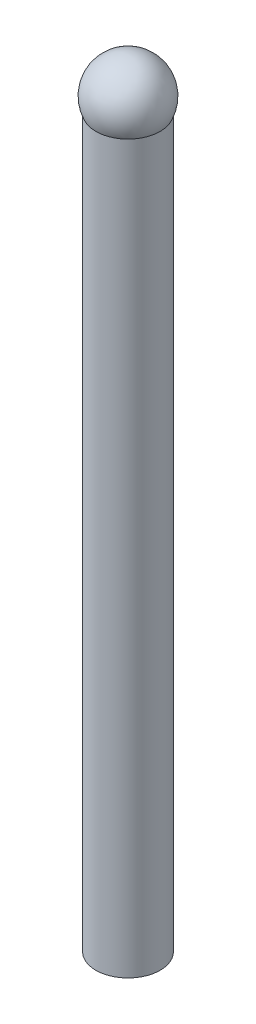
from build123d import *

# Parameters (mm, degrees)
SKETCH_1_R      = 0.65
EXTRUDE_1_DEPTH = 15


with BuildPart() as part:
    # Эскиз1 → Бобышка-Вытянуть1 (new body)
    with BuildSketch(Plane(origin=(0, 0, 0), x_dir=(1, 0, 0), z_dir=(0, 1, 0))):
        Circle(SKETCH_1_R)
    extrude(amount=EXTRUDE_1_DEPTH)

    # Эскиз3 → Повернуть23 (revolve)
    with BuildSketch(Plane.XY):
        with BuildLine():
            Line((-0.715433282, 15.000896847), (0.715433282, 15.000896847))
            ThreePointArc((0.715433282, 15.000896847), (0, 15.71633013), (-0.715433282, 15.000896847))
        make_face()
    revolve(axis=Axis((0.715433282, 15.000896847, 0), (-1, 0, 0)))


solid = part.part
